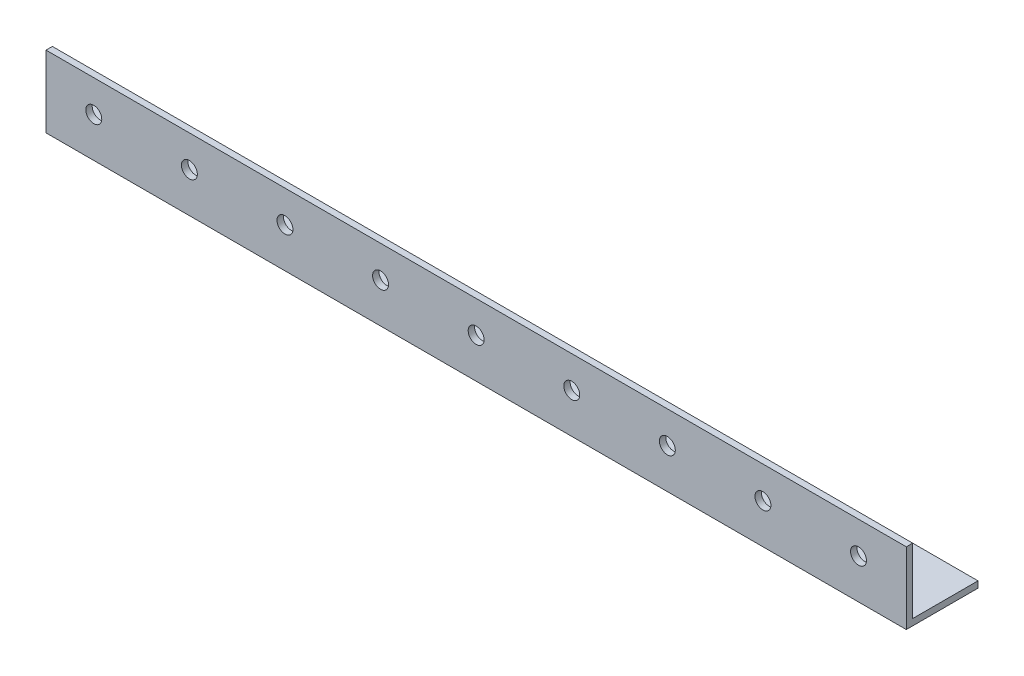
from build123d import *

# Parameters (mm, degrees)
EXTRUDE_1_DEPTH     = 540
SKETCH_2_R          = 5
CUT_EXTRUDE_1_DEPTH = 544.737068812
SKETCH_3_R          = 5
CUT_EXTRUDE_2_DEPTH = 544.737068812


with BuildPart() as part:
    # Эскиз1 → Вытянуть-Тонкостенный1 (new body)
    with BuildSketch(Plane(origin=(0, 0, 0), x_dir=(0, 0, -1), z_dir=(1, 0, 0))):
        Polygon((45, 0), (0, 0), (0, 45), (4, 45), (4, 4), (45, 4), align=None)
    extrude(amount=EXTRUDE_1_DEPTH)

    # Эскиз2 → Вырез-Вытянуть1 (cut, through all)
    with BuildSketch(Plane.XY):
        with Locations((30, 25)):
            Circle(SKETCH_2_R)
        with Locations((90, 25)):
            Circle(SKETCH_2_R)
        with Locations((150, 25)):
            Circle(SKETCH_2_R)
        with Locations((210, 25)):
            Circle(SKETCH_2_R)
        with Locations((270, 25)):
            Circle(SKETCH_2_R)
        with Locations((330, 25)):
            Circle(SKETCH_2_R)
        with Locations((390, 25)):
            Circle(SKETCH_2_R)
        with Locations((450, 25)):
            Circle(SKETCH_2_R)
        with Locations((510, 25)):
            Circle(SKETCH_2_R)
    extrude(amount=-CUT_EXTRUDE_1_DEPTH, mode=Mode.SUBTRACT)

    # Эскиз3 → Вырез-Вытянуть2 (cut, through all)
    with BuildSketch(Plane.XZ):
        with Locations((30, -25)):
            Circle(SKETCH_3_R)
        with Locations((90, -25)):
            Circle(SKETCH_3_R)
        with Locations((150, -25)):
            Circle(SKETCH_3_R)
        with Locations((210, -25)):
            Circle(SKETCH_3_R)
        with Locations((270, -25)):
            Circle(SKETCH_3_R)
        with Locations((330, -25)):
            Circle(SKETCH_3_R)
        with Locations((390, -25)):
            Circle(SKETCH_3_R)
        with Locations((450, -25)):
            Circle(SKETCH_3_R)
        with Locations((510, -25)):
            Circle(SKETCH_3_R)
    extrude(amount=-CUT_EXTRUDE_2_DEPTH, mode=Mode.SUBTRACT)


solid = part.part
